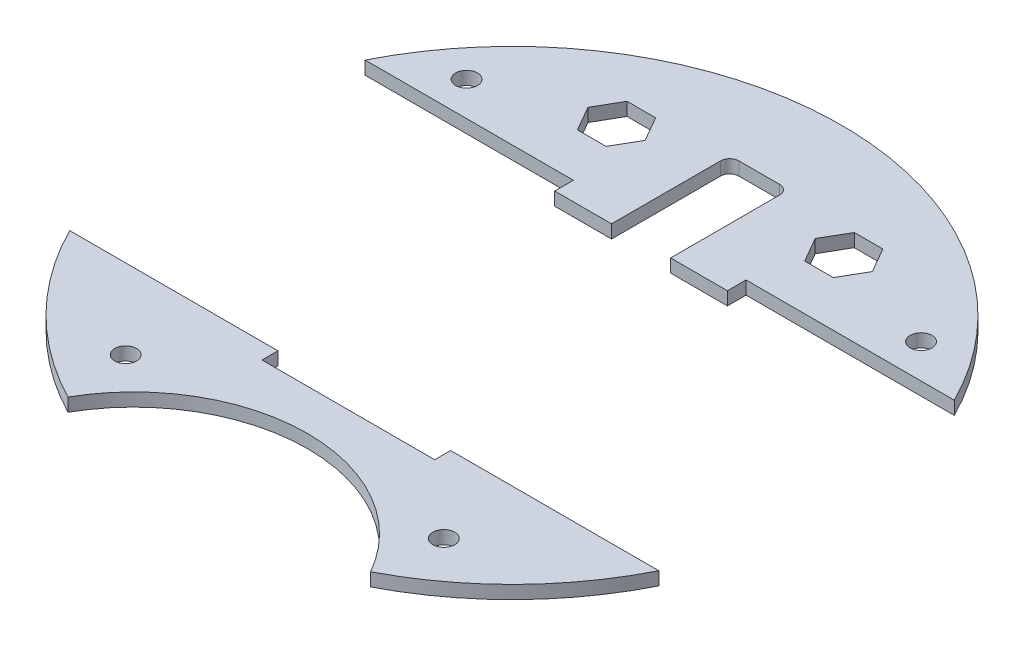
from build123d import *

# Parameters (mm, degrees)
BOSS_EXTRUDE1_DEPTH  = 2.9
SOLENOID_PLACEMENT_W = 38
SOLENOID_PLACEMENT_H = 64.4
CUT_EXTRUDE1_DEPTH   = 103.571487266
CUT_EXTRUDE4_DEPTH   = 103.571487266
CUT_EXTRUDE5_DEPTH   = 103.571487266
SKETCH6_R            = 2.4
CUT_EXTRUDE6_DEPTH   = 103.571487266
CUT_EXTRUDE3_DEPTH   = 103.571487266


with BuildPart() as part:
    # Sketch1 → Boss-Extrude1 (new body)
    with BuildSketch(Plane(origin=(0, 0, 0), x_dir=(1, 0, 0), z_dir=(0, 1, 0))):
        with BuildLine():
            ThreePointArc((33.29110537, -64.404598464), (0, 72.5), (-33.29110537, -64.404598464))
            ThreePointArc((-33.29110537, -64.404598464), (0, -44.989799638), (33.29110537, -64.404598464))
        make_face()
    extrude(amount=BOSS_EXTRUDE1_DEPTH)

    # solenoid placement → Cut-Extrude1 (cut, through all)
    with BuildSketch(Plane(origin=(0, 2.9, 0), x_dir=(1, 0, 0), z_dir=(0, 1, 0))):
        with Locations((0, -3.8)):
            Rectangle(SOLENOID_PLACEMENT_W, SOLENOID_PLACEMENT_H)
    extrude(amount=-CUT_EXTRUDE1_DEPTH, mode=Mode.SUBTRACT)

    # Sketch4 → Cut-Extrude4 (cut, through all)
    with BuildSketch(Plane(origin=(0, 2.9, 0), x_dir=(1, 0, 0), z_dir=(0, 1, 0))):
        with BuildLine():
            Line((-6.5, 28.1), (6.5, 28.1))
            Line((6.5, 28.1), (6.5, 52.4))
            ThreePointArc((6.5, 52.4), (5.914213562, 53.814213562), (4.5, 54.4))
            Line((4.5, 54.4), (-4.5, 54.4))
            ThreePointArc((-4.5, 54.4), (-5.914213562, 53.814213562), (-6.5, 52.4))
            Line((-6.5, 52.4), (-6.5, 28.1))
        make_face()
    extrude(amount=-CUT_EXTRUDE4_DEPTH, mode=Mode.SUBTRACT)

    # Sketch5 → Cut-Extrude5 (cut, through all)
    with BuildSketch(Plane(origin=(0, 2.9, 0), x_dir=(1, 0, 0), z_dir=(0, 1, 0))):
        Polygon((-18.706882066, 48), (-21.853441033, 53.45), (-28.146558967, 53.45), (-31.293117934, 48), (-28.146558967, 42.55), (-21.853441033, 42.55), align=None)
        Polygon((18.706882066, 48), (21.853441033, 42.55), (28.146558967, 42.55), (31.293117934, 48), (28.146558967, 53.45), (21.853441033, 53.45), align=None)
    extrude(amount=-CUT_EXTRUDE5_DEPTH, mode=Mode.SUBTRACT)

    # Sketch6 → Cut-Extrude6 (cut, through all)
    with BuildSketch(Plane(origin=(0, 2.9, 0), x_dir=(1, 0, 0), z_dir=(0, 1, 0))):
        with Locations((35, -50)):
            Circle(SKETCH6_R)
        with Locations((-35, -50)):
            Circle(SKETCH6_R)
        with Locations((-50, 40)):
            Circle(SKETCH6_R)
        with Locations((50, 40)):
            Circle(SKETCH6_R)
    extrude(amount=-CUT_EXTRUDE6_DEPTH, mode=Mode.SUBTRACT)

    # Sketch3 → Cut-Extrude3 (cut, through all)
    with BuildSketch(Plane(origin=(0, 2.9, 0), x_dir=(1, 0, 0), z_dir=(0, 1, 0))):
        Polygon((-19, 28.4), (-19, 32.5), (-72.5, 32.5), (-72.5, -32.5), (72.5, -32.5), (72.5, 32.5), (19, 32.5), (19, 28.4), align=None)
    extrude(amount=-CUT_EXTRUDE3_DEPTH, mode=Mode.SUBTRACT)


with BuildPart() as cut_extrude3_piece_1:
    # of the separate pieces the step leaves, piece 1, a body of its own (cut_extrude3_pieces)
    add(part.part.solids().sort_by_distance((64.807406984, 0, -32.5))[0])


with BuildPart() as cut_extrude3_piece_2:
    # of the separate pieces the step leaves, piece 2, a body of its own (cut_extrude3_pieces)
    add(part.part.solids().sort_by_distance((-33.29110537, 0, 64.404598464))[0])


solid = Compound([cut_extrude3_piece_1.part, cut_extrude3_piece_2.part])
